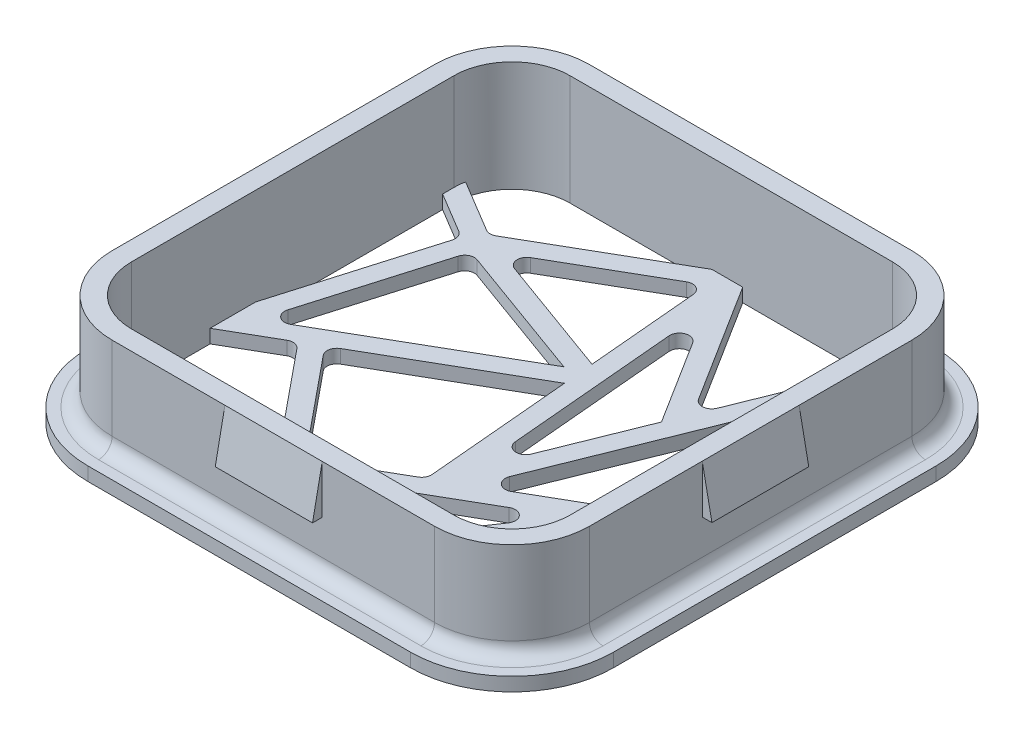
from build123d import *

# Parameters (mm, degrees)
BOSS_EXTRUDE1_DEPTH      = 1.4
BOSS_EXTRUDE2_DEPTH      = 10
FILLET1_R                = 1.4
CUT_EXTRUDE5_START       = -2
CUT_EXTRUDE5_DEPTH       = 2
BOSS_EXTRUDE4_DEPTH      = 5.05
BOSS_EXTRUDE4_DEPTH_BACK = 5
BOSS_EXTRUDE5_DEPTH      = 5.05
BOSS_EXTRUDE5_DEPTH_BACK = 5.05
BOSS_EXTRUDE8_DEPTH      = 5
BOSS_EXTRUDE8_DEPTH_BACK = 5
BOSS_EXTRUDE9_DEPTH      = 5
BOSS_EXTRUDE9_DEPTH_BACK = 5
BOSS_EXTRUDE6_DEPTH      = 5
BOSS_EXTRUDE6_DEPTH_BACK = 5


with BuildPart() as part:
    # Sketch1 → Boss-Extrude1 (new body)
    with BuildSketch(Plane(origin=(0, 0, 0), x_dir=(1, 0, 0), z_dir=(0, 1, 0))):
        with BuildLine():
            Line((-16.65, 27.15), (16.65, 27.15))
            ThreePointArc((16.65, 27.15), (24.074621202, 24.074621202), (27.15, 16.65))
            Line((27.15, 16.65), (27.15, -16.65))
            ThreePointArc((27.15, -16.65), (24.074621202, -24.074621202), (16.65, -27.15))
            Line((16.65, -27.15), (-16.65, -27.15))
            ThreePointArc((-16.65, -27.15), (-24.074621202, -24.074621202), (-27.15, -16.65))
            Line((-27.15, -16.65), (-27.15, 16.65))
            ThreePointArc((-27.15, 16.65), (-24.074621202, 24.074621202), (-16.65, 27.15))
        make_face()
    extrude(amount=-BOSS_EXTRUDE1_DEPTH)

    # Sketch2 → Boss-Extrude2 (add)
    with BuildSketch(Plane(origin=(0, 0, 0), x_dir=(1, 0, 0), z_dir=(0, 1, 0))):
        with BuildLine():
            Line((16.65, -24.65), (-16.65, -24.65))
            ThreePointArc((-16.65, -24.65), (-22.306854249, -22.306854249), (-24.65, -16.65))
            Line((-24.65, -16.65), (-24.65, 16.65))
            ThreePointArc((-24.65, 16.65), (-22.306854249, 22.306854249), (-16.65, 24.65))
            Line((-16.65, 24.65), (16.65, 24.65))
            ThreePointArc((16.65, 24.65), (22.306854249, 22.306854249), (24.65, 16.65))
            Line((24.65, 16.65), (24.65, -16.65))
            ThreePointArc((24.65, -16.65), (22.306854249, -22.306854249), (16.65, -24.65))
        make_face()
        with BuildLine():
            Line((16.65, 22.65), (-16.65, 22.65))
            ThreePointArc((-16.65, 22.65), (-20.892640687, 20.892640687), (-22.65, 16.65))
            Line((-22.65, 16.65), (-22.65, -16.65))
            ThreePointArc((-22.65, -16.65), (-20.892640687, -20.892640687), (-16.65, -22.65))
            Line((-16.65, -22.65), (16.65, -22.65))
            ThreePointArc((16.65, -22.65), (20.892640687, -20.892640687), (22.65, -16.65))
            Line((22.65, -16.65), (22.65, 16.65))
            ThreePointArc((22.65, 16.65), (20.892640687, 20.892640687), (16.65, 22.65))
        make_face(mode=Mode.SUBTRACT)
    extrude(amount=BOSS_EXTRUDE2_DEPTH)

    # Fillet1
    fillet1_edges = [part.edges().sort_by_distance(p)[0] for p in [
        (22.306854249, 0, -22.306854249),
        (24.65, 0, 0),
        (22.306854249, 0, 22.306854249),
        (0, 0, 24.65),
        (-22.306854249, 0, 22.306854249),
        (-24.65, 0, 0),
        (-22.306854249, 0, -22.306854249),
        (0, 0, -24.65),
    ]]
    fillet(fillet1_edges, radius=FILLET1_R)

    # Sketch9 → Cut-Extrude5 (cut)
    with BuildSketch(Plane(origin=(0, 0, 0), x_dir=(1, 0, 0), z_dir=(0, 1, 0)).offset(CUT_EXTRUDE5_START)):
        with BuildLine():
            Line((10.694016214, 10.507873373), (15.572309914, 22.65))
            Line((15.572309914, 22.65), (1.181391426, 22.65))
            Line((1.181391426, 22.65), (8.919646161, 10.348223182))
            ThreePointArc((8.919646161, 10.348223182), (9.855719358, 9.884699688), (10.694016214, 10.507873373))
        make_face()
        with BuildLine():
            ThreePointArc((22.65, 16.65), (21.251999389, 20.499883326), (17.709466125, 22.555720238))
            Line((17.709466125, 22.555720238), (22.65, 3.90520486))
            Line((22.65, 3.90520486), (22.65, 16.65))
        make_face()
        with BuildLine():
            Line((-16.130835351, 14.507414524), (-2.002640685, 22.65))
            Line((-2.002640685, 22.65), (-16.65, 22.65))
            ThreePointArc((-16.65, 22.65), (-20.482334383, 21.266623569), (-22.547481746, 17.754404391))
            Line((-22.547481746, 17.754404391), (-17.144250478, 14.516074659))
            ThreePointArc((-17.144250478, 14.516074659), (-16.638721235, 14.373856752), (-16.130835351, 14.507414524))
        make_face()
        with BuildLine():
            Line((22.65, -14.52824506), (22.65, -1.154193677))
            Line((22.65, -1.154193677), (18.02503984, -3.819724151))
            ThreePointArc((18.02503984, -3.819724151), (17.562937149, -4.411126946), (17.64241183, -5.157437831))
            Line((17.64241183, -5.157437831), (22.65, -14.52824506))
        make_face()
        with BuildLine():
            ThreePointArc((18.909199437, -22.208418652), (21.105584594, -20.668428291), (22.411387741, -18.325234698))
            Line((22.411387741, -18.325234698), (16.528178293, -7.315858575))
            ThreePointArc((16.528178293, -7.315858575), (15.698216688, -6.788519824), (14.817968248, -7.226794974))
            Line((14.817968248, -7.226794974), (7.616217422, -17.871139018))
            ThreePointArc((7.616217422, -17.871139018), (7.508491463, -18.783597538), (8.190895459, -19.398829379))
            Line((8.190895459, -19.398829379), (18.909199437, -22.208418652))
        make_face()
        with BuildLine():
            Line((-18.490656415, 12.991325169), (-22.65, 15.484153132))
            Line((-22.65, 15.484153132), (-22.65, -3.829289125))
            Line((-22.65, -3.829289125), (-18.045243909, 11.851826463))
            ThreePointArc((-18.045243909, 11.851826463), (-18.073355464, 12.497639889), (-18.490656415, 12.991325169))
        make_face()
        with BuildLine():
            Line((-17.622245914, -5.635014169), (-22.65, -8.532689233))
            Line((-22.65, -8.532689233), (-22.65, -16.65))
            ThreePointArc((-22.65, -16.65), (-21.430367573, -20.276028939), (-18.267304711, -22.427917053))
            Line((-18.267304711, -22.427917053), (-8.779151561, -16.959553979))
            ThreePointArc((-8.779151561, -16.959553979), (-8.294867657, -16.273377666), (-8.504401891, -15.460073149))
            Line((-8.504401891, -15.460073149), (-16.348814845, -5.868344772))
            ThreePointArc((-16.348814845, -5.868344772), (-16.942675811, -5.517795281), (-17.622245914, -5.635014169))
        make_face()
        with BuildLine():
            Line((-14.647359315, -22.65), (12.706211585, -22.65))
            Line((12.706211585, -22.65), (-5.698629645, -17.825538537))
            ThreePointArc((-5.698629645, -17.825538537), (-6.085036819, -17.801720357), (-6.451533643, -17.926451617))
            Line((-6.451533643, -17.926451617), (-14.647359315, -22.65))
        make_face()
        with BuildLine():
            ThreePointArc((-14.110252412, -3.610926311), (-14.594536317, -4.297102623), (-14.385002083, -5.11040714))
            Line((-14.385002083, -5.11040714), (-6.540589129, -14.702135517))
            ThreePointArc((-6.540589129, -14.702135517), (-5.946728162, -15.052685008), (-5.267158059, -14.93546612))
            Line((-5.267158059, -14.93546612), (1.394827695, -11.095924713))
            ThreePointArc((1.394827695, -11.095924713), (1.782508035, -10.691248002), (1.891611181, -10.14156101))
            Line((1.891611181, -10.14156101), (0.5679713, 4.848660638))
            Line((0.5679713, 4.848660638), (-14.110252412, -3.610926311))
        make_face()
        with BuildLine():
            ThreePointArc((6.083827903, -6.33170093), (6.356126115, -7.459601495), (7.511079151, -7.57090956))
            Line((7.511079151, -7.57090956), (20.823894593, 0.101743614))
            ThreePointArc((20.823894593, 0.101743614), (21.247741638, 0.583800025), (21.291212529, 1.224217844))
            Line((21.291212529, 1.224217844), (17.226230715, 16.569524192))
            ThreePointArc((17.226230715, 16.569524192), (16.321070727, 17.311562847), (15.33166153, 16.686258594))
            Line((15.33166153, 16.686258594), (6.083827903, -6.33170093))
        make_face()
        with BuildLine():
            ThreePointArc((-1.519739289, -15.084081588), (-2.011535565, -16.083331179), (-1.273961888, -16.917806101))
            Line((-1.273961888, -16.917806101), (4.088884799, -18.323569228))
            ThreePointArc((4.088884799, -18.323569228), (4.694535053, -18.292217726), (5.170689433, -17.916621996))
            Line((5.170689433, -17.916621996), (10.15753068, -10.545962388))
            ThreePointArc((10.15753068, -10.545962388), (10.061387193, -9.304391337), (8.829948645, -9.119185107))
            Line((8.829948645, -9.119185107), (-1.519739289, -15.084081588))
        make_face()
        with BuildLine():
            ThreePointArc((-0.720468105, 19.440236907), (-1.254863284, 20.239299961), (-2.21593299, 20.218684638))
            Line((-2.21593299, 20.218684638), (-12.425532687, 14.334526034))
            ThreePointArc((-12.425532687, 14.334526034), (-12.922371418, 13.380790236), (-12.267167791, 12.528048245))
            Line((-12.267167791, 12.528048245), (0.292123454, 7.9726375))
            Line((0.292123454, 7.9726375), (-0.720468105, 19.440236907))
        make_face()
        with BuildLine():
            Line((1.725355812, 14.47940982), (3.261538332, -2.917857224))
            ThreePointArc((3.261538332, -2.917857224), (4.111213095, -3.819117398), (5.185573067, -3.202702152))
            Line((5.185573067, -3.202702152), (9.042374321, 6.396918553))
            Line((9.042374321, 6.396918553), (3.567939501, 15.09982091))
            ThreePointArc((3.567939501, 15.09982091), (2.402376002, 15.515087511), (1.725355812, 14.47940982))
        make_face()
        with BuildLine():
            Line((-0.935636561, 6.290464836), (-14.98982424, 11.388093063))
            ThreePointArc((-14.98982424, 11.388093063), (-15.78244699, 11.340217738), (-16.290286978, 10.729774114))
            Line((-16.290286978, 10.729774114), (-20.284449881, -2.872016929))
            ThreePointArc((-20.284449881, -2.872016929), (-19.943429454, -3.939581213), (-18.825622247, -4.02017577))
            Line((-18.825622247, -4.02017577), (-0.935636561, 6.290464836))
        make_face()
    extrude(amount=CUT_EXTRUDE5_DEPTH, mode=Mode.SUBTRACT)

    # Sketch14 → Boss-Extrude5 (add, two sides: drawn at the far end of the back side and taken through both)
    with BuildSketch(Plane(origin=(0, 0, 0), x_dir=(0, 0, -1), z_dir=(1, 0, 0)).offset(-BOSS_EXTRUDE5_DEPTH_BACK)):
        Polygon((24.65, 10), (24.65, 5), (25.65, 5), align=None)
    extrude(amount=BOSS_EXTRUDE5_DEPTH + BOSS_EXTRUDE5_DEPTH_BACK)

    # Sketch17 → Boss-Extrude8 (add, two sides: drawn at the far end of the back side and taken through both)
    with BuildSketch(Plane.XY.offset(-BOSS_EXTRUDE8_DEPTH_BACK)):
        Polygon((24.65, 10), (24.65, 5), (25.65, 5), align=None)
    extrude(amount=BOSS_EXTRUDE8_DEPTH + BOSS_EXTRUDE8_DEPTH_BACK)

    # Sketch19 → Boss-Extrude9 (add, two sides: drawn at the far end of the back side and taken through both)
    with BuildSketch(Plane.XY.offset(-BOSS_EXTRUDE9_DEPTH_BACK)):
        Polygon((-24.65, 10), (-24.65, 5), (-25.65, 5), align=None)
    extrude(amount=BOSS_EXTRUDE9_DEPTH + BOSS_EXTRUDE9_DEPTH_BACK)

    # Sketch15 → Boss-Extrude6 (add, two sides: drawn at the far end of the back side and taken through both)
    with BuildSketch(Plane.XY.offset(-BOSS_EXTRUDE6_DEPTH_BACK)):
        Polygon((24.65, 10), (24.65, 5), (25.65, 5), align=None)
    extrude(amount=BOSS_EXTRUDE6_DEPTH + BOSS_EXTRUDE6_DEPTH_BACK)


with BuildPart() as body_2:
    # Sketch12 → Boss-Extrude4 (new, two sides: drawn at the far end of the back side and taken through both)
    with BuildSketch(Plane(origin=(0, 0, 0), x_dir=(0, 0, -1), z_dir=(1, 0, 0)).offset(-BOSS_EXTRUDE4_DEPTH_BACK)):
        Polygon((-25.65, 5), (-24.65, 5), (-24.65, 10), align=None)
    extrude(amount=BOSS_EXTRUDE4_DEPTH + BOSS_EXTRUDE4_DEPTH_BACK)


solid = Compound([part.part, body_2.part])
